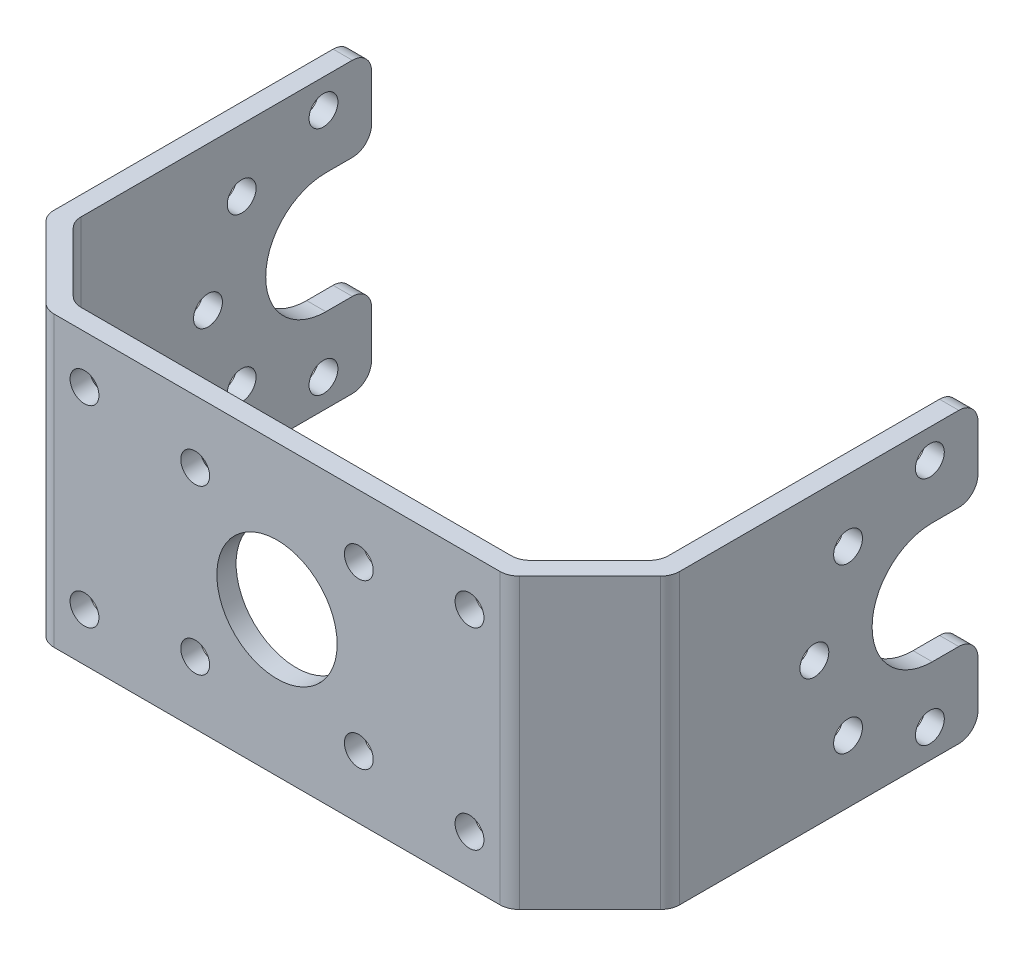
from build123d import *

# Parameters (mm, degrees)
BOSS_EXTRUDE2_DEPTH = 30
SKETCH2_R           = 1.5
CUT_EXTRUDE1_DEPTH  = 83.166793989
SKETCH3_R           = 6.25
SKETCH3_R_2         = 1.5
CUT_EXTRUDE2_DEPTH  = 10
FILLET1_R           = 2


with BuildPart() as part:
    # Sketch1 → Boss-Extrude2 (new body)
    with BuildSketch(Plane(origin=(0, 0, 0), x_dir=(1, 0, 0), z_dir=(0, 1, 0))):
        Polygon((0, -38.328427125), (23.171572875, -38.328427125), (30.5, -31), (30.5, 0), (32.5, 0), (32.5, -31.828427125), (24, -40.328427125), (0, -40.328427125), align=None)
    boss_extrude2 = extrude(amount=BOSS_EXTRUDE2_DEPTH)

    # Mirror1: Boss-Extrude2 across plane
    add(boss_extrude2.mirror(Plane(origin=(0, 0, 0), x_dir=(0, 0, 1), z_dir=(1, 0, 0))))

    # Sketch2 → Cut-Extrude1 (cut, through all)
    with BuildSketch(Plane(origin=(32.5, 0, 0), x_dir=(0, 0, -1), z_dir=(1, 0, 0))):
        with Locations((-17, 15)):
            Circle(SKETCH2_R)
        with Locations((-5, 3)):
            Circle(SKETCH2_R)
        with Locations((-13.5, 6.5)):
            Circle(SKETCH2_R)
        with Locations((-13.5, 23.5)):
            Circle(SKETCH2_R)
        with Locations((-5, 27)):
            Circle(SKETCH2_R)
        with BuildLine():
            Line((-4.75, 21.25), (0, 21.25))
            Line((0, 21.25), (0, 8.75))
            Line((0, 8.75), (-4.75, 8.75))
            ThreePointArc((-4.75, 8.75), (-11, 15), (-4.75, 21.25))
        make_face()
    extrude(amount=-CUT_EXTRUDE1_DEPTH, mode=Mode.SUBTRACT)

    # Sketch3 → Cut-Extrude2 (cut)
    with BuildSketch(Plane.XY.offset(40.328427125)):
        with Locations((0, 15)):
            Circle(SKETCH3_R)
        with Locations((8.5, 6.5)):
            Circle(SKETCH3_R_2)
        with Locations((8.5, 23.5)):
            Circle(SKETCH3_R_2)
        with Locations((20, 5)):
            Circle(SKETCH3_R_2)
        with Locations((20, 25)):
            Circle(SKETCH3_R_2)
        with Locations((-20, 5)):
            Circle(SKETCH3_R_2)
        with Locations((-8.5, 6.5)):
            Circle(SKETCH3_R_2)
        with Locations((-20, 25)):
            Circle(SKETCH3_R_2)
        with Locations((-8.5, 23.5)):
            Circle(SKETCH3_R_2)
    extrude(amount=-CUT_EXTRUDE2_DEPTH, mode=Mode.SUBTRACT)

    # Fillet1
    fillet1_edges = [part.edges().sort_by_distance(p)[0] for p in [
        (-23.171572875, 15, 38.328427125),
        (-30.5, 15, 31),
        (-24, 15, 40.328427125),
        (-32.5, 15, 31.828427125),
        (-31.5, 0, 0),
        (-31.5, 30, 0),
        (-31.5, 21.25, 0),
        (-31.5, 8.75, 0),
        (31.5, 0, 0),
        (31.5, 8.75, 0),
        (31.5, 21.25, 0),
        (31.5, 30, 0),
        (30.5, 15, 31),
        (23.171572875, 15, 38.328427125),
        (32.5, 15, 31.828427125),
        (24, 15, 40.328427125),
    ]]
    fillet(fillet1_edges, radius=FILLET1_R)


solid = part.part
